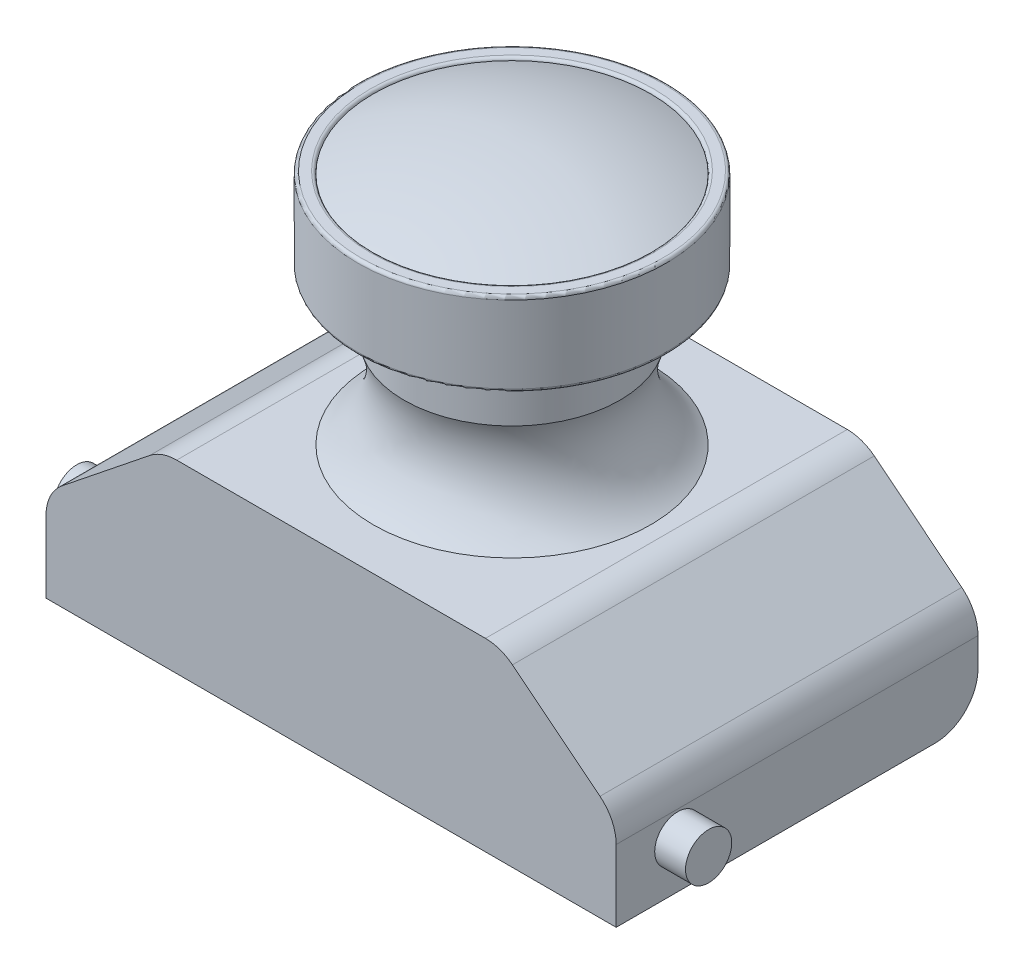
from build123d import *

# Parameters (mm, degrees)
BOSS_EXTRUDE1_DEPTH = 5.87
SKETCH6_R           = 0.75
BOSS_EXTRUDE2_DEPTH = 10.25
FILLET1_R           = 0.1
FILLET2_R           = 1.4
FILLET3_R           = 1.4


with BuildPart() as part:
    # Sketch1 → Boss-Extrude1 (new, symmetric)
    with BuildSketch(Plane.XY):
        Polygon((-9.25, 0), (9.25, 0), (9.25, 3), (5.5, 6), (-5.5, 6), (-9.25, 3), align=None)
    extrude(amount=BOSS_EXTRUDE1_DEPTH, both=True)

    # Sketch2 → Revolve5 (revolve)
    with BuildSketch(Plane.XY, mode=Mode.PRIVATE) as revolve5_sk:
        with BuildLine():
            ThreePointArc((3.5, 9), (3.465409062, 7.321803021), (4.5, 6))
            Line((4.5, 6), (0, 6))
            Line((0, 6), (0, 13.5))
            Line((0, 13.5), (4.5, 13.5))
            Line((4.5, 13.5), (4.5, 13.7))
            Line((4.5, 13.7), (5, 13.7))
            Line((5, 13.7), (5, 11))
            Line((5, 11), (3.5, 11))
            Line((3.5, 11), (3.5, 9))
        make_face()
    revolve(revolve5_sk.sketch.rotate(Axis((0, 13.5, 0), (0, -1, 0)), 90), axis=Axis((0, 13.5, 0), (0, -1, 0)))

    # Sketch3 → Revolve6 (revolve)
    with BuildSketch(Plane.XY, mode=Mode.PRIVATE) as revolve6_sk:
        with BuildLine():
            Line((0, 13.5), (0, 14.541750876))
            ThreePointArc((0, 14.541750876), (2.431447351, 14.278254553), (4.75, 13.5))
            Line((4.75, 13.5), (0, 13.5))
        make_face()
    revolve(revolve6_sk.sketch.rotate(Axis((0, 20.298095722, 0), (0, -1, 0)), 90), axis=Axis((0, 20.298095722, 0), (0, -1, 0)))

    # Sketch6 → Boss-Extrude2 (add, symmetric)
    with BuildSketch(Plane.ZY):
        with Locations((3.87, 1.5)):
            Circle(SKETCH6_R)
    extrude(amount=BOSS_EXTRUDE2_DEPTH, both=True)

    # Fillet1
    # the kernel refuses this fillet: 0.1 mm, written as the material it takes off along each edge
    with BuildSketch(Plane(origin=(0, 11, 0), x_dir=(0, 0, 1), z_dir=(1, 0, 0))) as fillet1_piece_1:
        with BuildLine():
            CenterArc((5 - FILLET1_R, -FILLET1_R), FILLET1_R, 0, 90)
            Line((5, -FILLET1_R), (5, 0))
            Line((5, 0), (5 - FILLET1_R, 0))
        make_face()
    revolve(axis=Axis((0, 11, 0), (0, -1, 0)), mode=Mode.SUBTRACT)
    with BuildSketch(Plane(origin=(0, 13.7, 0), x_dir=(0, 0, 1), z_dir=(1, 0, 0))) as fillet1_piece_2:
        with BuildLine():
            CenterArc((5 - FILLET1_R, FILLET1_R), FILLET1_R, 270, 90)
            Line((5 - FILLET1_R, 0), (5, 0))
            Line((5, 0), (5, FILLET1_R))
        make_face()
    revolve(axis=Axis((0, 13.7, 0), (0, -1, 0)), mode=Mode.SUBTRACT)
    with BuildSketch(Plane(origin=(0, 13.7, 0), x_dir=(0, 0, 1), z_dir=(1, 0, 0))) as fillet1_piece_3:
        with BuildLine():
            CenterArc((4.59932915, 0.1), FILLET1_R, 186.640387385, 83.359612615)
            Line((4.5, 0.088436266), (4.5, 0))
            Line((4.5, 0), (4.59932915, 0))
        make_face()
    revolve(axis=Axis((0, 13.7, 0), (0, -1, 0)), mode=Mode.SUBTRACT)

    # Fillet2
    fillet2_edges = [part.edges().sort_by_distance(p)[0] for p in [
        (-9.25, 3, 0),
        (-5.5, 6, 0),
        (9.25, 3, 0),
        (0, 0, -5.87),
    ]]
    fillet(fillet2_edges, radius=FILLET2_R)

    # Fillet3
    fillet3_edges = [part.edges().sort_by_distance(p)[0] for p in [
        (5.5, 6, 0),
    ]]
    fillet(fillet3_edges, radius=FILLET3_R)


solid = part.part
